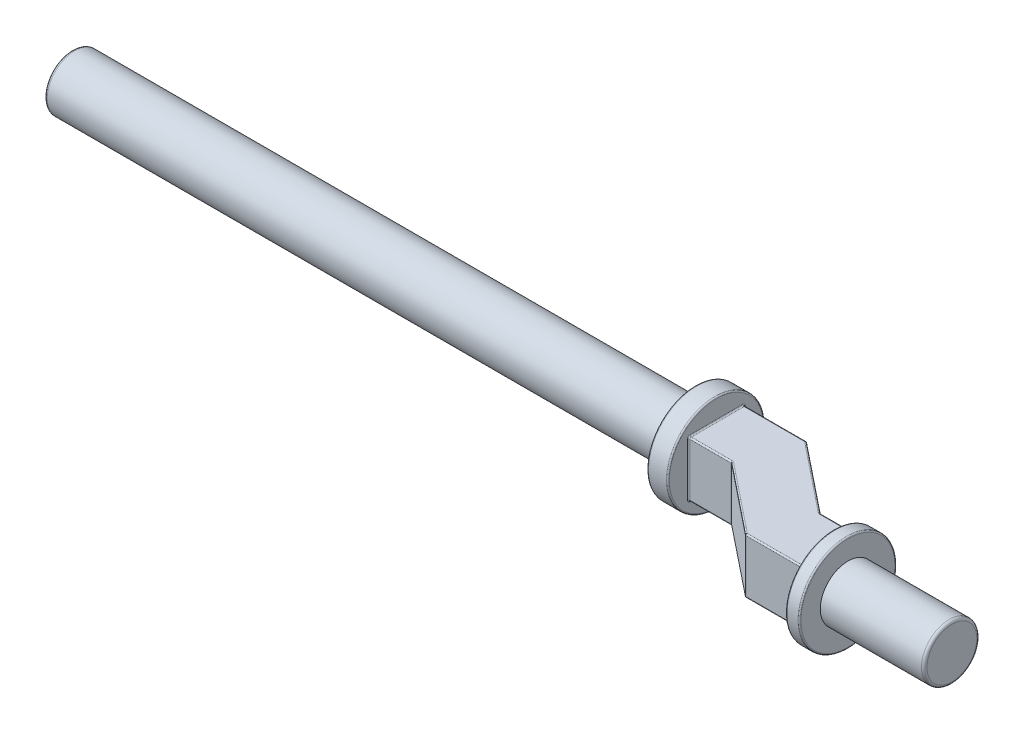
from build123d import *

# Parameters (mm, degrees)
SKETCH_1_R           = 2
EXTRUDE_1_DEPTH      = 45
SKETCH_2_R           = 3.5
EXTRUDE_2_DEPTH      = 1.5
EXTRUDE_3_DEPTH      = 2
EXTRUDE_3_DEPTH_BACK = 2
SKETCH_4_R           = 3.5
EXTRUDE_4_DEPTH      = 1
SKETCH_5_R           = 2
EXTRUDE_5_DEPTH      = 7.5
FILLET_1_R           = 0.2
FILLET_2_R           = 0.1


with BuildPart() as part:
    # 草图1 → 凸台-拉伸1 (new body)
    with BuildSketch(Plane(origin=(0, 0, 0), x_dir=(0, 0, -1), z_dir=(1, 0, 0))):
        Circle(SKETCH_1_R)
    extrude(amount=EXTRUDE_1_DEPTH)

    # 草图2 → 凸台-拉伸2 (add)
    with BuildSketch(Plane(origin=(45, 0, 0), x_dir=(0, 0, -1), z_dir=(1, 0, 0))):
        Circle(SKETCH_2_R)
    extrude(amount=EXTRUDE_2_DEPTH)

    # 草图3 → 凸台-拉伸3 (add, two sides: drawn at the far end of the back side and taken through both)
    with BuildSketch(Plane(origin=(0, 0, 0), x_dir=(1, 0, 0), z_dir=(0, 1, 0)).offset(-EXTRUDE_3_DEPTH_BACK)):
        Polygon((46.5, 2), (51, 2), (56, -2), (59, -2), (59, -6), (54.596875763, -6), (49.596875763, -2), (46.5, -2), align=None)
    extrude(amount=EXTRUDE_3_DEPTH + EXTRUDE_3_DEPTH_BACK)

    # 草图4 → 凸台-拉伸4 (add)
    with BuildSketch(Plane(origin=(59, 0, 0), x_dir=(0, 0, -1), z_dir=(1, 0, 0))):
        with Locations((-4, 0)):
            Circle(SKETCH_4_R)
    extrude(amount=EXTRUDE_4_DEPTH)

    # 草图5 → 凸台-拉伸5 (add)
    with BuildSketch(Plane(origin=(60, 0, 0), x_dir=(0, 0, -1), z_dir=(1, 0, 0))):
        with Locations((-4, 0)):
            Circle(SKETCH_5_R)
    extrude(amount=EXTRUDE_5_DEPTH)

    # 圆角1
    fillet_1_edges = [part.edges().sort_by_distance(p)[0] for p in [
        (0, 0, 2),
        (67.5, 0, 6),
    ]]
    fillet(fillet_1_edges, radius=FILLET_1_R)

    # 圆角2
    fillet_2_edges = [part.edges().sort_by_distance(p)[0] for p in [
        (54.596875763, 0, 6),
        (59, 0, 6),
        (46.5, 0, 2),
        (49.596875763, 0, 2),
        (59, 0, 2),
        (56, 0, 2),
        (51, 0, -2),
        (46.5, 0, -2),
        (48.048437881, -2, 2),
        (52.096875763, -2, 4),
        (56.798437881, -2, 6),
        (59, -2, 4),
        (57.5, -2, 2),
        (53.5, -2, 0),
        (48.75, -2, -2),
        (46.5, -2, 0),
        (48.75, 2, -2),
        (53.5, 2, 0),
        (57.5, 2, 2),
        (59, 2, 4),
        (56.798437881, 2, 6),
        (52.096875763, 2, 4),
        (48.048437881, 2, 2),
        (46.5, 2, 0),
        (59, 0, 7.5),
        (60, 0, 7.5),
        (45, 0, 3.5),
        (46.5, 0, 3.5),
    ]]
    fillet(fillet_2_edges, radius=FILLET_2_R)


solid = part.part
